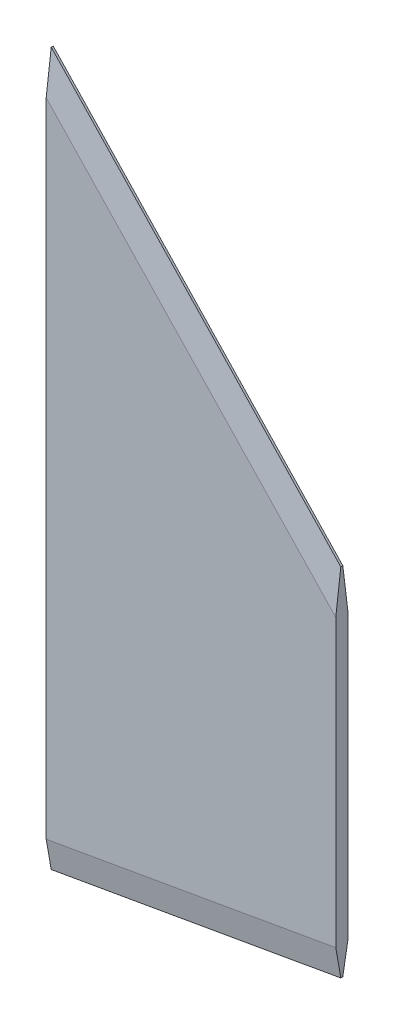
from build123d import *
from OCP.BRepFilletAPI import BRepFilletAPI_MakeChamfer

# Parameters (mm, degrees)
BOSS_EXTRUDE1_DEPTH = 1.5
CHAMFER1_SIZE       = 1.25
CHAMFER1_SIZE2      = 7.089102275


with BuildPart() as part:
    # Sketch1 → Boss-Extrude1 (new, symmetric)
    with BuildSketch(Plane.XY):
        Polygon((-60.98159975, 52.682371786), (-60.98159975, -125.117628214), (11.31315025, -112.417628214), (11.31315025, -23.517628214), align=None)
    extrude(amount=BOSS_EXTRUDE1_DEPTH, both=True)

    # Chamfer1: one chamfer whose edges measure the first distance from different faces: ONE call of the kernel's chamfer builder (chamfer() names one face for all edges)
    chamfer1_edges_1 = [part.edges().sort_by_distance(p)[0] for p in [
        (-24.83422475, -118.767628214, -1.5),
        (-24.83422475, -118.767628214, 1.5),
    ]]
    chamfer1_side_1 = [part.faces().sort_by_distance(p)[0] for p in [
        (-24.83422475, -118.767628214, 0),
    ]]
    chamfer1_edges_2 = [part.edges().sort_by_distance(p)[0] for p in [
        (-24.83422475, 14.582371786, -1.5),
        (-24.83422475, 14.582371786, 1.5),
    ]]
    chamfer1_side_2 = [part.faces().sort_by_distance(p)[0] for p in [
        (-24.83422475, 14.582371786, 0),
    ]]
    chamfer1 = BRepFilletAPI_MakeChamfer(part.part.solid().wrapped)
    for e in chamfer1_edges_1:
        chamfer1.Add(CHAMFER1_SIZE, CHAMFER1_SIZE2, e.wrapped, chamfer1_side_1[0].wrapped)  # the first distance lies on this face
    for e in chamfer1_edges_2:
        chamfer1.Add(CHAMFER1_SIZE, CHAMFER1_SIZE2, e.wrapped, chamfer1_side_2[0].wrapped)  # the first distance lies on this face
    add(Compound.cast(chamfer1.Shape()), mode=Mode.REPLACE)


solid = part.part
